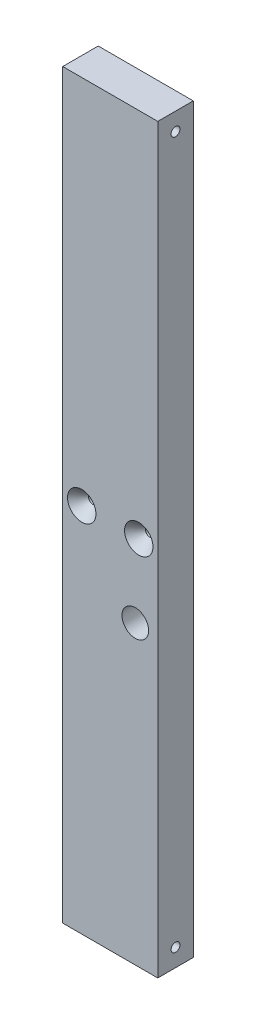
from build123d import *

# Parameters (mm, degrees)
SKETCH1_W                    = 34
SKETCH1_H                    = 265.399999988
BOSS_EXTRUDE1_DEPTH          = 12.7
F_3_8_0_375_DIAMETER_HOLE1_D = 9.525
HOLE1_D                      = 3.175
HOLE1_DEPTH                  = 31.75
HOLE1_CSINK_D                = 10.16
HOLE1_CSINK_ANGLE            = 82
HOLE1_TIP                    = 0.953866233
HOLE3_D                      = 3.175
HOLE3_DEPTH                  = 31.75
HOLE3_CSINK_D                = 10.16
HOLE3_CSINK_ANGLE            = 82
HOLE3_TIP                    = 0.953866233
HOLE4_D                      = 3.175
HOLE4_DEPTH                  = 31.75
HOLE4_CSINK_D                = 10.16
HOLE4_CSINK_ANGLE            = 82
HOLE4_TIP                    = 0.953866233


with BuildPart() as part:
    # Sketch1 → Boss-Extrude1 (new body)
    with BuildSketch(Plane.XY):
        with Locations((-23.08092085, 0)):
            Rectangle(SKETCH1_W, SKETCH1_H)
    extrude(amount=-BOSS_EXTRUDE1_DEPTH)

    # 3/8 (0.375) Diameter Hole1 (through all)
    with Locations(Plane.XY):
        with Locations((-14.118005489, -26.732654045)):
            Hole(F_3_8_0_375_DIAMETER_HOLE1_D / 2)

    # Hole1
    with Locations(Plane(origin=(12.91907915, 0, 155.024290059), x_dir=(0, -1, 0), z_dir=(1, 0, 0))):
        with Locations((126.349999994, 161.374290059), (146.083333327, 4.074290059), (172.166666661, 4.074290059), (126.349999994, 34.524290059), (126.349999994, 130.924290059), (-172.166666661, 4.074290059), (-146.083333327, 4.074290059), (-126.349999994, 34.524290059), (-126.349999994, 130.924290059), (-126.349999994, 161.374290059)):
            CounterSinkHole(HOLE1_D / 2, HOLE1_CSINK_D / 2, depth=HOLE1_DEPTH, counter_sink_angle=HOLE1_CSINK_ANGLE)
            with Locations((0, 0, -(HOLE1_DEPTH + HOLE1_TIP / 2))):  # 118° drill point
                Cone(0, HOLE1_D / 2, HOLE1_TIP, mode=Mode.SUBTRACT)

    # Hole3
    with Locations(Plane(origin=(-195.367659426, 0, 0), x_dir=(0, -1, 0), z_dir=(0, 0, 1))):
        with Locations((0, 162.086738577), (0, 182.486738577)):
            CounterSinkHole(HOLE3_D / 2, HOLE3_CSINK_D / 2, depth=HOLE3_DEPTH, counter_sink_angle=HOLE3_CSINK_ANGLE)
            with Locations((0, 0, -(HOLE3_DEPTH + HOLE3_TIP / 2))):  # 118° drill point
                Cone(0, HOLE3_D / 2, HOLE3_TIP, mode=Mode.SUBTRACT)

    # Hole4
    with Locations(Plane(origin=(-52.78092085, 0, 155.024290059), x_dir=(0, 1, 0), z_dir=(-1, 0, 0))):
        with Locations((-207.774999994, 333.02141023), (-207.774999994, 225.48903684), (-207.774999994, 137.424290059), (-172.166666661, 4.074290059), (-146.083333327, 4.074290059), (-94.599999994, 161.374290059), (0, 161.374290059), (94.599999994, 161.374290059), (146.083333327, 4.074290059), (172.166666661, 4.074290059), (207.774999994, 137.424290059), (207.774999994, 225.48903684), (207.774999994, 333.02141023), (166.795833328, 301.970350905), (40.979166666, 301.970350905), (-40.979166666, 301.970350905), (-166.795833328, 301.970350905), (0, 193.124290059), (0, 301.970350905), (0, 412.366411751), (-126.349999994, 106.824290059), (-126.349999994, 58.624290059), (126.349999994, 58.624290059), (126.349999994, 106.824290059)):
            CounterSinkHole(HOLE4_D / 2, HOLE4_CSINK_D / 2, depth=HOLE4_DEPTH, counter_sink_angle=HOLE4_CSINK_ANGLE)
            with Locations((0, 0, -(HOLE4_DEPTH + HOLE4_TIP / 2))):  # 118° drill point
                Cone(0, HOLE4_D / 2, HOLE4_TIP, mode=Mode.SUBTRACT)


solid = part.part
